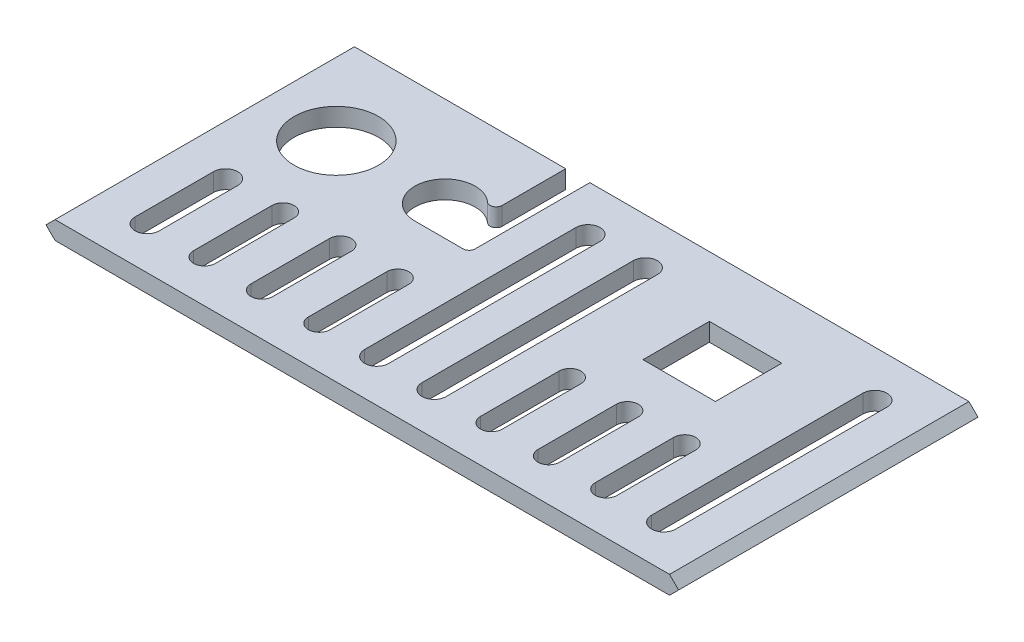
from build123d import *

# Parameters (mm, degrees)
BOSS_EXTRUDE1_DEPTH = 49.6
CUT_EXTRUDE1_REACH  = 74.214
SKETCH5_R           = 7
SKETCH5_W           = 12
SKETCH5_H           = 11
FILLET1_R           = 1


with BuildPart() as part:
    # Sketch4 → Boss-Extrude1 (new body)
    with BuildSketch(Plane.XY):
        Polygon((-50.9, 0), (50.9, 0), (52.4, -1.5), (50.9, -3), (-50.9, -3), (-52.4, -1.5), align=None)
    extrude(amount=BOSS_EXTRUDE1_DEPTH)

    # Sketch5 → Cut-Extrude1 (cut, up to next)
    with BuildSketch(Plane(origin=(0, 0, 0), x_dir=(1, 0, 0), z_dir=(0, 1, 0)), mode=Mode.PRIVATE) as cut_extrude1_sk1:
        with Locations((-38.9, -15)):
            Circle(SKETCH5_R)
    cut_extrude1_tool1 = extrude(cut_extrude1_sk1.sketch, amount=-CUT_EXTRUDE1_REACH, mode=Mode.PRIVATE) & part.part
    # Sketch5 → Cut-Extrude1 (cut, up to next)
    with BuildSketch(Plane(origin=(0, 0, 0), x_dir=(1, 0, 0), z_dir=(0, 1, 0)), mode=Mode.PRIVATE) as cut_extrude1_sk2:
        with Locations((23.9, -15.5)):
            Rectangle(SKETCH5_W, SKETCH5_H)
    cut_extrude1_tool2 = extrude(cut_extrude1_sk2.sketch, amount=-CUT_EXTRUDE1_REACH, mode=Mode.PRIVATE) & part.part
    # Sketch5 → Cut-Extrude1 (cut, up to next)
    with BuildSketch(Plane(origin=(0, 0, 0), x_dir=(1, 0, 0), z_dir=(0, 1, 0)), mode=Mode.PRIVATE) as cut_extrude1_sk3:
        with BuildLine():
            Line((-15.9, -15), (-15.9, 0))
            Line((-15.9, 0), (-11.9, 0))
            Line((-11.9, 0), (-11.9, -20))
            Line((-11.9, -20), (-20.9, -20))
            ThreePointArc((-20.9, -20), (-24.435533906, -11.464466094), (-15.9, -15))
        make_face()
    cut_extrude1_tool3 = extrude(cut_extrude1_sk3.sketch, amount=-CUT_EXTRUDE1_REACH, mode=Mode.PRIVATE) & part.part
    # Sketch5 → Cut-Extrude1 (cut, up to next)
    with BuildSketch(Plane(origin=(0, 0, 0), x_dir=(1, 0, 0), z_dir=(0, 1, 0)), mode=Mode.PRIVATE) as cut_extrude1_sk4:
        with BuildLine():
            Line((-44.656064428, -42.593823795), (-44.656064428, -29.593823795))
            ThreePointArc((-44.656064428, -29.593823795), (-42.656064428, -27.593823795), (-40.656064428, -29.593823795))
            Line((-40.656064428, -29.593823795), (-40.656064428, -42.593823795))
            ThreePointArc((-40.656064428, -42.593823795), (-42.656064428, -44.593823795), (-44.656064428, -42.593823795))
        make_face()
    cut_extrude1_tool4 = extrude(cut_extrude1_sk4.sketch, amount=-CUT_EXTRUDE1_REACH, mode=Mode.PRIVATE) & part.part
    # Sketch5 → Cut-Extrude1 (cut, up to next)
    with BuildSketch(Plane(origin=(0, 0, 0), x_dir=(1, 0, 0), z_dir=(0, 1, 0)), mode=Mode.PRIVATE) as cut_extrude1_sk5:
        with BuildLine():
            Line((40.917781725, -42.593823795), (40.917781725, -7.593823795))
            ThreePointArc((40.917781725, -7.593823795), (42.917781725, -5.593823795), (44.917781725, -7.593823795))
            Line((44.917781725, -7.593823795), (44.917781725, -42.593823795))
            ThreePointArc((44.917781725, -42.593823795), (42.917781725, -44.593823795), (40.917781725, -42.593823795))
        make_face()
    cut_extrude1_tool5 = extrude(cut_extrude1_sk5.sketch, amount=-CUT_EXTRUDE1_REACH, mode=Mode.PRIVATE) & part.part
    # Sketch5 → Cut-Extrude1 (cut, up to next)
    with BuildSketch(Plane(origin=(0, 0, 0), x_dir=(1, 0, 0), z_dir=(0, 1, 0)), mode=Mode.PRIVATE) as cut_extrude1_sk6:
        with BuildLine():
            Line((-34.965522839, -42.593823795), (-34.965522839, -29.593823795))
            ThreePointArc((-34.965522839, -29.593823795), (-33.146064428, -27.774365385), (-31.326606018, -29.593823795))
            Line((-31.326606018, -29.593823795), (-31.326606018, -42.593823795))
            ThreePointArc((-31.326606018, -42.593823795), (-33.146064428, -44.413282206), (-34.965522839, -42.593823795))
        make_face()
    cut_extrude1_tool6 = extrude(cut_extrude1_sk6.sketch, amount=-CUT_EXTRUDE1_REACH, mode=Mode.PRIVATE) & part.part
    # Sketch5 → Cut-Extrude1 (cut, up to next)
    with BuildSketch(Plane(origin=(0, 0, 0), x_dir=(1, 0, 0), z_dir=(0, 1, 0)), mode=Mode.PRIVATE) as cut_extrude1_sk7:
        with BuildLine():
            Line((-25.457830531, -42.593823795), (-25.457830531, -29.593823795))
            ThreePointArc((-25.457830531, -29.593823795), (-23.638372121, -27.774365385), (-21.81891371, -29.593823795))
            Line((-21.81891371, -29.593823795), (-21.81891371, -42.593823795))
            ThreePointArc((-21.81891371, -42.593823795), (-23.638372121, -44.413282206), (-25.457830531, -42.593823795))
        make_face()
    cut_extrude1_tool7 = extrude(cut_extrude1_sk7.sketch, amount=-CUT_EXTRUDE1_REACH, mode=Mode.PRIVATE) & part.part
    # Sketch5 → Cut-Extrude1 (cut, up to next)
    with BuildSketch(Plane(origin=(0, 0, 0), x_dir=(1, 0, 0), z_dir=(0, 1, 0)), mode=Mode.PRIVATE) as cut_extrude1_sk8:
        with BuildLine():
            Line((-15.950138223, -42.593823795), (-15.950138223, -29.593823795))
            ThreePointArc((-15.950138223, -29.593823795), (-14.130679813, -27.774365385), (-12.311221403, -29.593823795))
            Line((-12.311221403, -29.593823795), (-12.311221403, -42.593823795))
            ThreePointArc((-12.311221403, -42.593823795), (-14.130679813, -44.413282206), (-15.950138223, -42.593823795))
        make_face()
    cut_extrude1_tool8 = extrude(cut_extrude1_sk8.sketch, amount=-CUT_EXTRUDE1_REACH, mode=Mode.PRIVATE) & part.part
    # Sketch5 → Cut-Extrude1 (cut, up to next)
    with BuildSketch(Plane(origin=(0, 0, 0), x_dir=(1, 0, 0), z_dir=(0, 1, 0)), mode=Mode.PRIVATE) as cut_extrude1_sk9:
        with BuildLine():
            Line((-6.622987505, -42.593823795), (-6.622987505, -7.593823795))
            ThreePointArc((-6.622987505, -7.593823795), (-4.622987505, -5.593823795), (-2.622987505, -7.593823795))
            Line((-2.622987505, -7.593823795), (-2.622987505, -42.593823795))
            ThreePointArc((-2.622987505, -42.593823795), (-4.622987505, -44.593823795), (-6.622987505, -42.593823795))
        make_face()
    cut_extrude1_tool9 = extrude(cut_extrude1_sk9.sketch, amount=-CUT_EXTRUDE1_REACH, mode=Mode.PRIVATE) & part.part
    # Sketch5 → Cut-Extrude1 (cut, up to next)
    with BuildSketch(Plane(origin=(0, 0, 0), x_dir=(1, 0, 0), z_dir=(0, 1, 0)), mode=Mode.PRIVATE) as cut_extrude1_sk10:
        with BuildLine():
            Line((2.884704802, -42.593823795), (2.884704802, -7.593823795))
            ThreePointArc((2.884704802, -7.593823795), (4.884704802, -5.593823795), (6.884704802, -7.593823795))
            Line((6.884704802, -7.593823795), (6.884704802, -42.593823795))
            ThreePointArc((6.884704802, -42.593823795), (4.884704802, -44.593823795), (2.884704802, -42.593823795))
        make_face()
    cut_extrude1_tool10 = extrude(cut_extrude1_sk10.sketch, amount=-CUT_EXTRUDE1_REACH, mode=Mode.PRIVATE) & part.part
    # Sketch5 → Cut-Extrude1 (cut, up to next)
    with BuildSketch(Plane(origin=(0, 0, 0), x_dir=(1, 0, 0), z_dir=(0, 1, 0)), mode=Mode.PRIVATE) as cut_extrude1_sk11:
        with BuildLine():
            Line((12.5729387, -42.593823795), (12.5729387, -29.593823795))
            ThreePointArc((12.5729387, -29.593823795), (14.39239711, -27.774365385), (16.211855521, -29.593823795))
            Line((16.211855521, -29.593823795), (16.211855521, -42.593823795))
            ThreePointArc((16.211855521, -42.593823795), (14.39239711, -44.413282206), (12.5729387, -42.593823795))
        make_face()
    cut_extrude1_tool11 = extrude(cut_extrude1_sk11.sketch, amount=-CUT_EXTRUDE1_REACH, mode=Mode.PRIVATE) & part.part
    # Sketch5 → Cut-Extrude1 (cut, up to next)
    with BuildSketch(Plane(origin=(0, 0, 0), x_dir=(1, 0, 0), z_dir=(0, 1, 0)), mode=Mode.PRIVATE) as cut_extrude1_sk12:
        with BuildLine():
            Line((22.080631007, -42.593823795), (22.080631007, -29.593823795))
            ThreePointArc((22.080631007, -29.593823795), (23.900089418, -27.774365385), (25.719547828, -29.593823795))
            Line((25.719547828, -29.593823795), (25.719547828, -42.593823795))
            ThreePointArc((25.719547828, -42.593823795), (23.900089418, -44.413282206), (22.080631007, -42.593823795))
        make_face()
    cut_extrude1_tool12 = extrude(cut_extrude1_sk12.sketch, amount=-CUT_EXTRUDE1_REACH, mode=Mode.PRIVATE) & part.part
    # Sketch5 → Cut-Extrude1 (cut, up to next)
    with BuildSketch(Plane(origin=(0, 0, 0), x_dir=(1, 0, 0), z_dir=(0, 1, 0)), mode=Mode.PRIVATE) as cut_extrude1_sk13:
        with BuildLine():
            Line((31.588323315, -42.593823795), (31.588323315, -29.593823795))
            ThreePointArc((31.588323315, -29.593823795), (33.407781725, -27.774365385), (35.227240136, -29.593823795))
            Line((35.227240136, -29.593823795), (35.227240136, -42.593823795))
            ThreePointArc((35.227240136, -42.593823795), (33.407781725, -44.413282206), (31.588323315, -42.593823795))
        make_face()
    cut_extrude1_tool13 = extrude(cut_extrude1_sk13.sketch, amount=-CUT_EXTRUDE1_REACH, mode=Mode.PRIVATE) & part.part
    add(cut_extrude1_tool1.solids().sort_by_distance((-38.9, 0, 15))[0], mode=Mode.SUBTRACT)
    add(cut_extrude1_tool2.solids().sort_by_distance((23.9, 0, 15.5))[0], mode=Mode.SUBTRACT)
    add(cut_extrude1_tool3.solids().sort_by_distance((-17.356278, 0, 12.686666))[0], mode=Mode.SUBTRACT)
    add(cut_extrude1_tool4.solids().sort_by_distance((-42.656064, 0, 36.093824))[0], mode=Mode.SUBTRACT)
    add(cut_extrude1_tool5.solids().sort_by_distance((42.917782, 0, 25.093824))[0], mode=Mode.SUBTRACT)
    add(cut_extrude1_tool6.solids().sort_by_distance((-33.146064, 0, 36.093824))[0], mode=Mode.SUBTRACT)
    add(cut_extrude1_tool7.solids().sort_by_distance((-23.638372, 0, 36.093824))[0], mode=Mode.SUBTRACT)
    add(cut_extrude1_tool8.solids().sort_by_distance((-14.13068, 0, 36.093824))[0], mode=Mode.SUBTRACT)
    add(cut_extrude1_tool9.solids().sort_by_distance((-4.622988, 0, 25.093824))[0], mode=Mode.SUBTRACT)
    add(cut_extrude1_tool10.solids().sort_by_distance((4.884705, 0, 25.093824))[0], mode=Mode.SUBTRACT)
    add(cut_extrude1_tool11.solids().sort_by_distance((14.392397, 0, 36.093824))[0], mode=Mode.SUBTRACT)
    add(cut_extrude1_tool12.solids().sort_by_distance((23.900089, 0, 36.093824))[0], mode=Mode.SUBTRACT)
    add(cut_extrude1_tool13.solids().sort_by_distance((33.407782, 0, 36.093824))[0], mode=Mode.SUBTRACT)

    # Fillet1
    fillet1_edges = [part.edges().sort_by_distance(p)[0] for p in [
        (-11.9, -1.5, 20),
    ]]
    fillet(fillet1_edges, radius=FILLET1_R)
    fillet1_2_edges = [part.edges().sort_by_distance(p)[0] for p in [
        (-15.9, -1.5, 15),
    ]]
    fillet(fillet1_2_edges, radius=FILLET1_R)


solid = part.part
